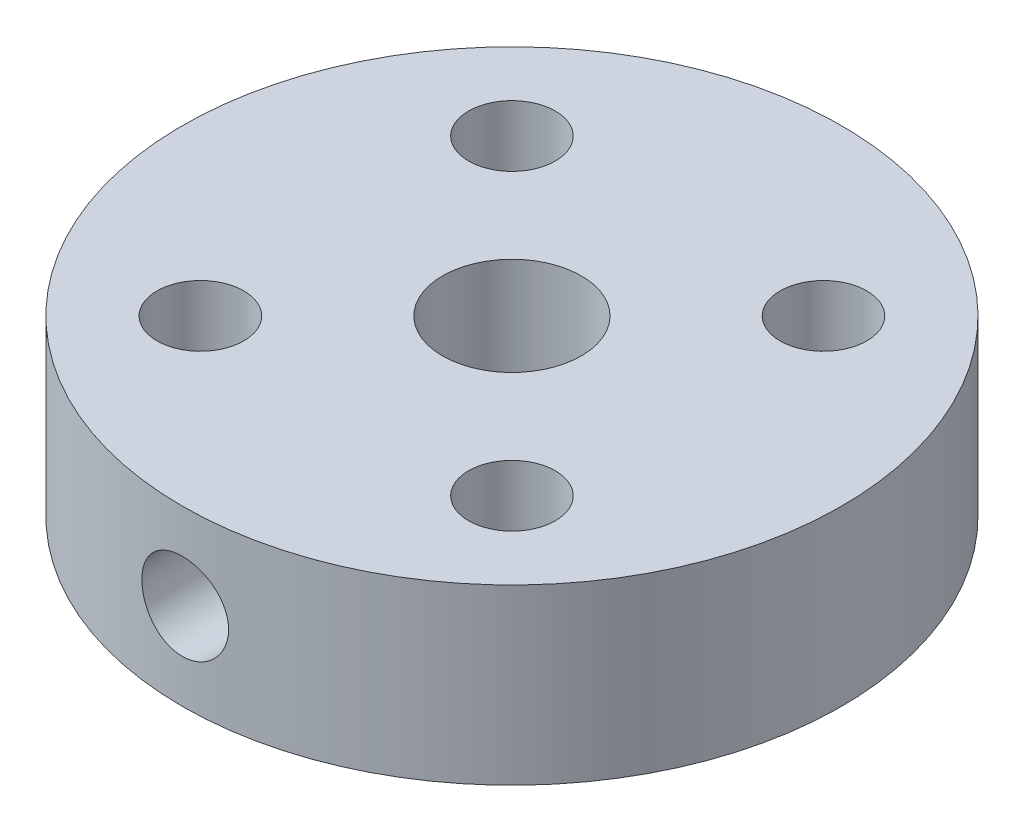
from build123d import *

# Parameters (mm, degrees)
SKETCH1_R           = 9.5
SKETCH1_R_2         = 2
SKETCH1_R_3         = 1.25
BOSS_EXTRUDE1_DEPTH = 5
CUT_EXTRUDE1_REACH  = 23.823
SKETCH3_R           = 1.25


with BuildPart() as part:
    # Sketch1 → Boss-Extrude1 (new body)
    with BuildSketch(Plane(origin=(0, 0, 0), x_dir=(1, 0, 0), z_dir=(0, 1, 0))):
        Circle(SKETCH1_R)
        Circle(SKETCH1_R_2, mode=Mode.SUBTRACT)
        with Locations((4.490128061, 4.490128061)):
            Circle(SKETCH1_R_3, mode=Mode.SUBTRACT)
        with Locations((-4.490128061, 4.490128061)):
            Circle(SKETCH1_R_3, mode=Mode.SUBTRACT)
        with Locations((4.490128061, -4.490128061)):
            Circle(SKETCH1_R_3, mode=Mode.SUBTRACT)
        with Locations((-4.490128061, -4.490128061)):
            Circle(SKETCH1_R_3, mode=Mode.SUBTRACT)
    extrude(amount=BOSS_EXTRUDE1_DEPTH)

    # Sketch3 → Cut-Extrude1 (cut, up to next)
    with BuildSketch(Plane.XY.offset(9.5), mode=Mode.PRIVATE) as cut_extrude1_sk1:
        with Locations((0, 2.5)):
            Circle(SKETCH3_R)
    cut_extrude1_tool1 = extrude(cut_extrude1_sk1.sketch, amount=-CUT_EXTRUDE1_REACH, mode=Mode.PRIVATE) & part.part
    add(cut_extrude1_tool1.solids().sort_by_distance((0, 2.5, 9.5))[0], mode=Mode.SUBTRACT)


solid = part.part
